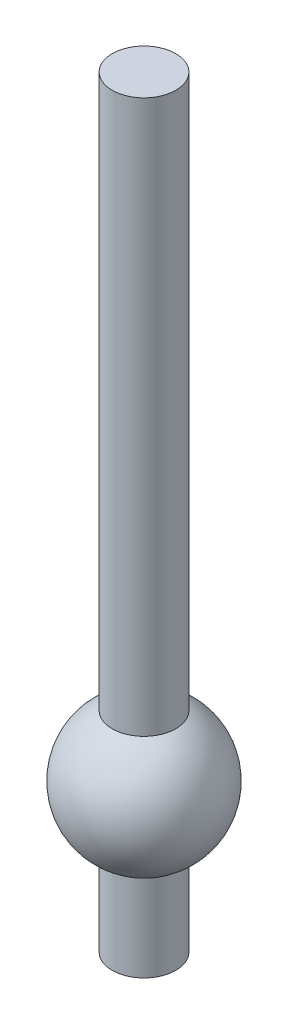
from build123d import *

# Parameters (mm, degrees)
REVOLVE1_ANGLE = 359.999695921


with BuildPart() as part:
    # Sketch1 → Revolve1 (revolve)
    with BuildSketch(Plane.XY):
        with BuildLine():
            Line((0, 0), (3, 0))
            Line((3, 0), (3, 8.233718703))
            ThreePointArc((3, 8.233718703), (6.5, 14), (3, 19.766281297))
            Line((3, 19.766281297), (3, 72))
            Line((3, 72), (0, 72))
            Line((0, 72), (0, 0))
        make_face()
    revolve(axis=Axis((0, 0, 0), (0, 1, 0)), revolution_arc=REVOLVE1_ANGLE)


solid = part.part
